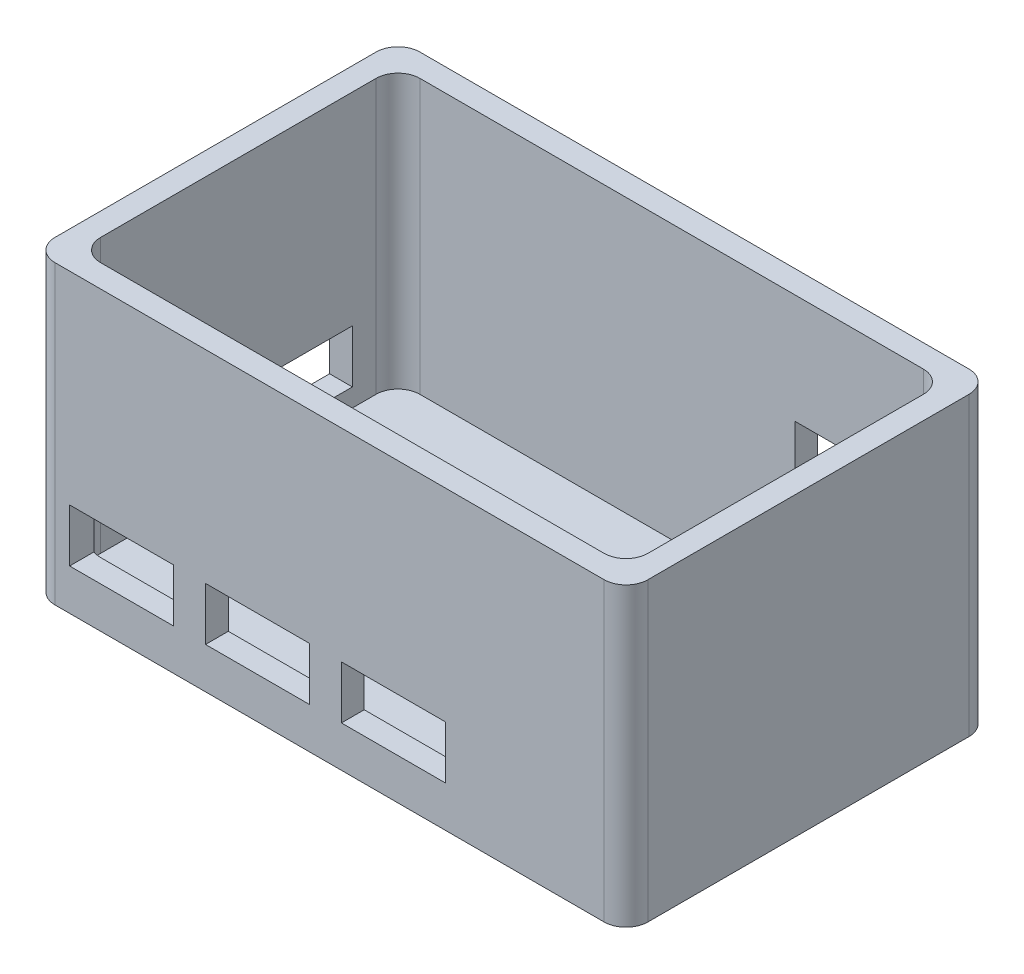
from build123d import *

# Parameters (mm, degrees)
SKETCH1_W           = 76.2
SKETCH1_H           = 44.45
BOSS_EXTRUDE1_DEPTH = 38.1
SHELL1_T            = 3.175
SKETCH2_W           = 14.478
SKETCH2_H           = 7.366
CUT_EXTRUDE1_DEPTH  = 12.7
SKETCH3_W           = 25.4
SKETCH3_H           = 7.366
CUT_EXTRUDE2_DEPTH  = 12.7
SKETCH4_W           = 14.605
SKETCH4_H           = 19.05
CUT_EXTRUDE3_DEPTH  = 12.7
FILLET1_R           = 3.048


with BuildPart() as part:
    # Sketch1 → Boss-Extrude1 (new body)
    with BuildSketch(Plane(origin=(0, 0, 0), x_dir=(1, 0, 0), z_dir=(0, 1, 0))):
        with Locations((38.1, -22.225)):
            Rectangle(SKETCH1_W, SKETCH1_H)
    extrude(amount=BOSS_EXTRUDE1_DEPTH)

    # Shell1
    shell1_openings = [part.faces().sort_by_distance(p)[0] for p in [
        (38.1, 38.1, 22.225),
    ]]
    offset(amount=SHELL1_T, openings=shell1_openings, kind=Kind.INTERSECTION)

    # Sketch2 → Cut-Extrude1 (cut)
    with BuildSketch(Plane.XY.offset(47.625)):
        with Locations((46.99, 6.223)):
            Rectangle(SKETCH2_W, SKETCH2_H)
        with Locations((9.144, 6.223)):
            Rectangle(SKETCH2_W, SKETCH2_H)
        with Locations((28.067, 6.223)):
            Rectangle(SKETCH2_W, SKETCH2_H)
    extrude(amount=-CUT_EXTRUDE1_DEPTH, mode=Mode.SUBTRACT)

    # Sketch3 → Cut-Extrude2 (cut)
    with BuildSketch(Plane.ZY.offset(3.175)):
        with Locations((19.05, 6.223)):
            Rectangle(SKETCH3_W, SKETCH3_H)
    extrude(amount=-CUT_EXTRUDE2_DEPTH, mode=Mode.SUBTRACT)

    # Sketch4 → Cut-Extrude3 (cut)
    with BuildSketch(Plane(origin=(0, 0, -3.175), x_dir=(-1, 0, 0), z_dir=(0, 0, -1))):
        with Locations((-62.5475, 13.335)):
            Rectangle(SKETCH4_W, SKETCH4_H)
    extrude(amount=-CUT_EXTRUDE3_DEPTH, mode=Mode.SUBTRACT)

    # Fillet1
    # the kernel refuses this fillet: 3.048 mm, written as the material it adds along each edge
    with BuildSketch(Plane(origin=(0, 0, 0), x_dir=(1, 0, 0), z_dir=(0, 1, 0))) as fillet1_piece_1:
        with BuildLine():
            CenterArc((FILLET1_R, -FILLET1_R), FILLET1_R, 90, 90)
            Line((0, -FILLET1_R), (0, 0))
            Line((0, 0), (FILLET1_R, 0))
        make_face()
    extrude(amount=38.1)
    with BuildSketch(Plane(origin=(0, 0, 44.45), x_dir=(0, 0, -1), z_dir=(0, 1, 0))) as fillet1_piece_2_section:
        with BuildLine():
            CenterArc((FILLET1_R, -FILLET1_R), FILLET1_R, 90, 90)
            Line((0, -FILLET1_R), (0, 0))
            Line((0, 0), (FILLET1_R, 0))
        make_face()
    fillet1_piece_2 = extrude(amount=38.1, mode=Mode.PRIVATE)
    fillet1_piece_2 = split(fillet1_piece_2, bisect_by=Plane(origin=(1.905, 1.27, 43.71379522), z_dir=(-1, 0, 0)), keep=Keep.TOP, mode=Mode.PRIVATE)
    fillet1_piece_2 = split(fillet1_piece_2, bisect_by=Plane(origin=(0.57743071, 2.54, 43.71379522), z_dir=(0, -1, 0)), keep=Keep.TOP, mode=Mode.PRIVATE)
    add(fillet1_piece_2)
    with BuildSketch(Plane(origin=(0, 0, 44.45), x_dir=(0, 0, -1), z_dir=(0, 1, 0))) as fillet1_piece_3_section:
        with BuildLine():
            CenterArc((FILLET1_R, -FILLET1_R), FILLET1_R, 90, 90)
            Line((0, -FILLET1_R), (0, 0))
            Line((0, 0), (FILLET1_R, 0))
        make_face()
    fillet1_piece_3 = extrude(amount=38.1, mode=Mode.PRIVATE)
    fillet1_piece_3 = split(fillet1_piece_3, bisect_by=Plane(origin=(1.905, 1.27, 44.427738201), z_dir=(1, 0, 0)), keep=Keep.TOP, mode=Mode.PRIVATE)
    fillet1_piece_3 = split(fillet1_piece_3, bisect_by=Plane(origin=(2.319599586, 2.54, 44.427738201), z_dir=(0, -1, 0)), keep=Keep.TOP, mode=Mode.PRIVATE)
    add(fillet1_piece_3)
    with BuildSketch(Plane(origin=(0, 0, 44.45), x_dir=(0, 0, -1), z_dir=(0, 1, 0))) as fillet1_piece_4_section:
        with BuildLine():
            CenterArc((FILLET1_R, -FILLET1_R), FILLET1_R, 90, 90)
            Line((0, -FILLET1_R), (0, 0))
            Line((0, 0), (FILLET1_R, 0))
        make_face()
    fillet1_piece_4 = extrude(amount=38.1, mode=Mode.PRIVATE)
    fillet1_piece_4 = split(fillet1_piece_4, bisect_by=Plane(origin=(1.905, 6.223, 43.71379522), z_dir=(-1, 0, 0)), keep=Keep.TOP, mode=Mode.PRIVATE)
    fillet1_piece_4 = split(fillet1_piece_4, bisect_by=Plane(origin=(0.57743071, 2.54, 43.71379522), z_dir=(0, 1, 0)), keep=Keep.TOP, mode=Mode.PRIVATE)
    fillet1_piece_4 = split(fillet1_piece_4, bisect_by=Plane(origin=(0.57743071, 9.906, 43.71379522), z_dir=(0, -1, 0)), keep=Keep.TOP, mode=Mode.PRIVATE)
    add(fillet1_piece_4)
    with BuildSketch(Plane(origin=(0, 0, 44.45), x_dir=(0, 0, -1), z_dir=(0, 1, 0))) as fillet1_piece_5_section:
        with BuildLine():
            CenterArc((FILLET1_R, -FILLET1_R), FILLET1_R, 90, 90)
            Line((0, -FILLET1_R), (0, 0))
            Line((0, 0), (FILLET1_R, 0))
        make_face()
    fillet1_piece_5 = extrude(amount=38.1, mode=Mode.PRIVATE)
    fillet1_piece_5 = split(fillet1_piece_5, bisect_by=Plane(origin=(1.905, 24.003, 43.71379522), z_dir=(-1, 0, 0)), keep=Keep.TOP, mode=Mode.PRIVATE)
    fillet1_piece_5 = split(fillet1_piece_5, bisect_by=Plane(origin=(0.57743071, 9.906, 43.71379522), z_dir=(0, 1, 0)), keep=Keep.TOP, mode=Mode.PRIVATE)
    add(fillet1_piece_5)
    with BuildSketch(Plane(origin=(0, 0, 44.45), x_dir=(0, 0, -1), z_dir=(0, 1, 0))) as fillet1_piece_6_section:
        with BuildLine():
            CenterArc((FILLET1_R, -FILLET1_R), FILLET1_R, 90, 90)
            Line((0, -FILLET1_R), (0, 0))
            Line((0, 0), (FILLET1_R, 0))
        make_face()
    fillet1_piece_6 = extrude(amount=38.1, mode=Mode.PRIVATE)
    fillet1_piece_6 = split(fillet1_piece_6, bisect_by=Plane(origin=(1.905, 24.003, 44.427738201), z_dir=(1, 0, 0)), keep=Keep.TOP, mode=Mode.PRIVATE)
    fillet1_piece_6 = split(fillet1_piece_6, bisect_by=Plane(origin=(2.319599586, 9.906, 44.427738201), z_dir=(0, 1, 0)), keep=Keep.TOP, mode=Mode.PRIVATE)
    add(fillet1_piece_6)
    with BuildSketch(Plane(origin=(76.2, 0, 44.45), x_dir=(0, 0, -1), z_dir=(0, 1, 0)), Plane(origin=(76.2, 0, 0), x_dir=(-1, 0, 0), z_dir=(0, 1, 0))) as fillet1_piece_7:
        with BuildLine():
            CenterArc((FILLET1_R, FILLET1_R), FILLET1_R, 180, 90)
            Line((0, FILLET1_R), (0, 0))
            Line((0, 0), (FILLET1_R, 0))
        make_face()
    extrude(amount=38.1)
    # the kernel refuses this fillet: 3.048 mm, written as the material it takes off along each edge
    with BuildSketch(Plane(origin=(-3.175, -10.795, -3.175), x_dir=(1, 0, 0), z_dir=(0, 1, 0)), Plane(origin=(79.375, 45.72, -3.175), x_dir=(-1, 0, 0), z_dir=(0, -1, 0))) as fillet1_2_piece_1:
        with BuildLine():
            CenterArc((FILLET1_R, -FILLET1_R), FILLET1_R, 90, 90)
            Line((0, -FILLET1_R), (0, 0))
            Line((0, 0), (FILLET1_R, 0))
        make_face()
    extrude(amount=56.515, mode=Mode.SUBTRACT)
    with BuildSketch(Plane(origin=(-3.175, 45.72, 47.625), x_dir=(0, 0, -1), z_dir=(0, -1, 0)), Plane(origin=(79.375, 45.72, 47.625), x_dir=(-1, 0, 0), z_dir=(0, -1, 0))) as fillet1_2_piece_2:
        with BuildLine():
            CenterArc((FILLET1_R, FILLET1_R), FILLET1_R, 180, 90)
            Line((0, FILLET1_R), (0, 0))
            Line((0, 0), (FILLET1_R, 0))
        make_face()
    extrude(amount=56.515, mode=Mode.SUBTRACT)


solid = part.part
